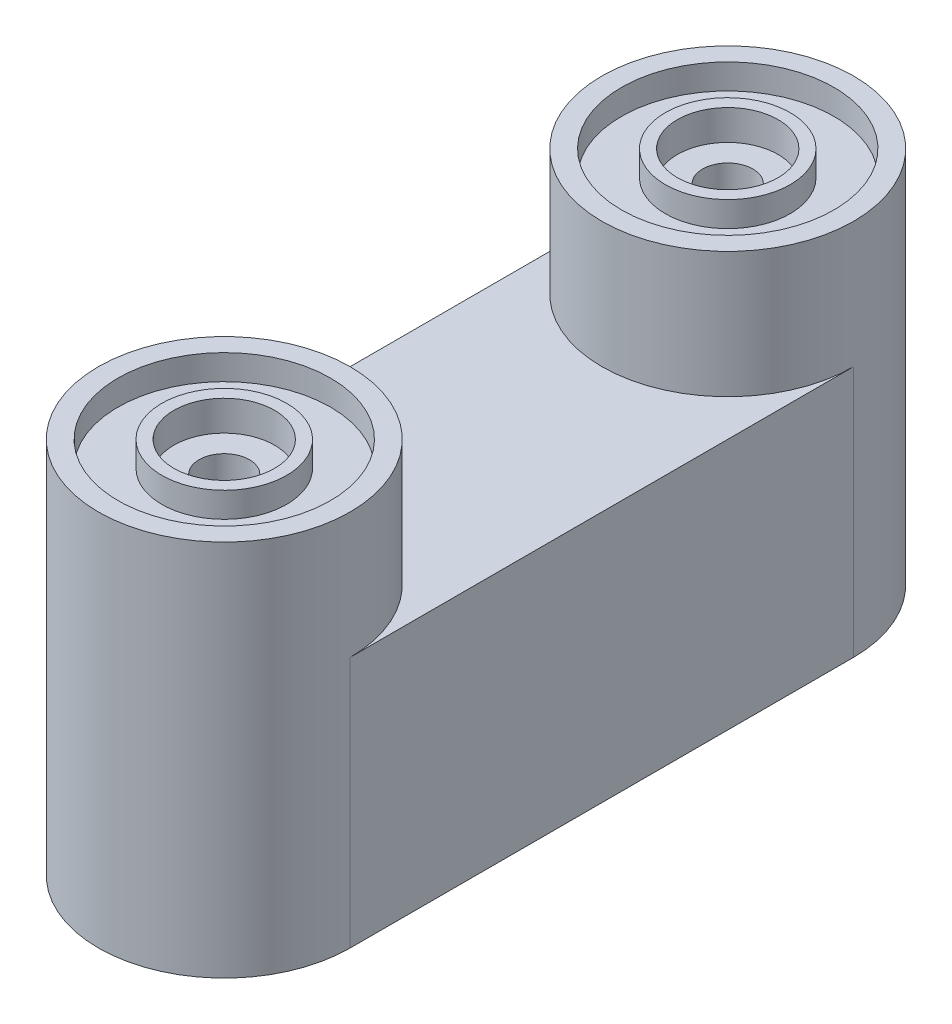
from build123d import *

# Parameters (mm, degrees)
SKIZZE1_W                       = 50
SKIZZE1_H                       = 50
AUFSATZ_LINEAR_AUSTRAGEN1_DEPTH = 150
SKIZZE2_W                       = 50
SKIZZE2_H                       = 50
AUFSATZ_LINEAR_AUSTRAGEN2_DEPTH = 25
SCHNITT_LINEAR_AUSTRAGEN1_DEPTH = 25
SCHNITT_LINEAR_AUSTRAGEN2_DEPTH = 50
SKIZZE5_R                       = 5
SCHNITT_LINEAR_AUSTRAGEN3_DEPTH = 75
SKIZZE6_R                       = 10
SCHNITT_LINEAR_AUSTRAGEN4_DEPTH = 6
SCHNITT_LINEAR_START            = -6
SKIZZE7_R                       = 10
SCHNITT_LINEAR_AUSTRAGEN5_DEPTH = 6
SKIZZE8_R                       = 21.1
SKIZZE8_R_2                     = 12.4
SCHNITT_LINEAR_AUSTRAGEN6_DEPTH = 5


with BuildPart() as part:
    # Skizze1 → Aufsatz-Linear austragen1 (new body)
    with BuildSketch(Plane.XY):
        Rectangle(SKIZZE1_W, SKIZZE1_H)
    extrude(amount=AUFSATZ_LINEAR_AUSTRAGEN1_DEPTH)

    # Skizze2 → Aufsatz-Linear austragen2 (add)
    with BuildSketch(Plane(origin=(0, 25, 0), x_dir=(1, 0, 0), z_dir=(0, 1, 0))):
        with Locations((0, -125)):
            Rectangle(SKIZZE2_W, SKIZZE2_H)
        with Locations((0, -25)):
            Rectangle(SKIZZE2_W, SKIZZE2_H)
    extrude(amount=AUFSATZ_LINEAR_AUSTRAGEN2_DEPTH)

    # Skizze3 → Schnitt-Linear austragen1 (cut)
    with BuildSketch(Plane(origin=(0, 50, 0), x_dir=(1, 0, 0), z_dir=(0, 1, 0))):
        with BuildLine():
            Line((4.2e-08, 0), (-25, 0))
            Line((-25, 0), (-25, -25))
            ThreePointArc((-25, -25), (-17.677669515, -7.322330455), (4.2e-08, 0))
        make_face()
        with BuildLine():
            Line((25, 0), (4.2e-08, 0))
            ThreePointArc((4.2e-08, 0), (17.677669545, -7.322330485), (25, -25))
            Line((25, -25), (25, 0))
        make_face()
        with BuildLine():
            ThreePointArc((0, -50), (-17.67766953, -42.67766953), (-25, -25))
            Line((-25, -25), (-25, -50))
            Line((-25, -50), (0, -50))
        make_face()
        with BuildLine():
            Line((25, -50), (25, -25))
            ThreePointArc((25, -25), (17.67766953, -42.67766953), (0, -50))
            Line((0, -50), (25, -50))
        make_face()
        with BuildLine():
            Line((-3.2e-08, -100), (-25, -100))
            Line((-25, -100), (-25, -125))
            ThreePointArc((-25, -125), (-17.677669541, -107.322330482), (-3.2e-08, -100))
        make_face()
        with BuildLine():
            Line((25, -100), (-3.2e-08, -100))
            ThreePointArc((-3.2e-08, -100), (17.677669518, -107.322330459), (25, -125))
            Line((25, -125), (25, -100))
        make_face()
        with BuildLine():
            ThreePointArc((5.8e-08, -150), (-17.677669509, -142.67766955), (-25, -125))
            Line((-25, -125), (-25, -150))
            Line((-25, -150), (5.8e-08, -150))
        make_face()
        with BuildLine():
            Line((25, -150), (25, -125))
            ThreePointArc((25, -125), (17.67766955, -142.677669509), (5.8e-08, -150))
            Line((5.8e-08, -150), (25, -150))
        make_face()
    extrude(amount=-SCHNITT_LINEAR_AUSTRAGEN1_DEPTH, mode=Mode.SUBTRACT)

    # Skizze4 → Schnitt-Linear austragen2 (cut)
    with BuildSketch(Plane(origin=(0, 25, 0), x_dir=(1, 0, 0), z_dir=(0, 1, 0))):
        with BuildLine():
            Line((25, -150), (25, -125))
            ThreePointArc((25, -125), (17.677669466, -142.677669593), (-1.79e-07, -150))
            Line((-1.79e-07, -150), (25, -150))
        make_face()
        with BuildLine():
            Line((-25, 0), (-25, -25))
            ThreePointArc((-25, -25), (-17.67766953, -7.32233047), (0, 0))
            Line((0, 0), (-25, 0))
        make_face()
        with BuildLine():
            Line((25, 0), (0, 0))
            ThreePointArc((0, 0), (17.67766953, -7.32233047), (25, -25))
            Line((25, -25), (25, 0))
        make_face()
        with BuildLine():
            ThreePointArc((-1.79e-07, -150), (-17.677669593, -142.677669466), (-25, -125))
            Line((-25, -125), (-25, -150))
            Line((-25, -150), (-1.79e-07, -150))
        make_face()
    extrude(amount=-SCHNITT_LINEAR_AUSTRAGEN2_DEPTH, mode=Mode.SUBTRACT)

    # Skizze5 → Schnitt-Linear austragen3 (cut)
    with BuildSketch(Plane(origin=(0, 50, 0), x_dir=(1, 0, 0), z_dir=(0, 1, 0))):
        with Locations((0, -25)):
            Circle(SKIZZE5_R)
        with Locations((0, -125)):
            Circle(SKIZZE5_R)
    extrude(amount=-SCHNITT_LINEAR_AUSTRAGEN3_DEPTH, mode=Mode.SUBTRACT)

    # Skizze6 → Schnitt-Linear austragen4 (cut)
    with BuildSketch(Plane(origin=(0, 50, 0), x_dir=(1, 0, 0), z_dir=(0, 1, 0))):
        with Locations((0, -125)):
            Circle(SKIZZE6_R)
        with Locations((0, -25)):
            Circle(SKIZZE6_R)
    extrude(amount=-SCHNITT_LINEAR_AUSTRAGEN4_DEPTH, mode=Mode.SUBTRACT)

    # Skizze7 → Schnitt-Linear austragen5 (cut)
    with BuildSketch(Plane.XZ.offset(25).offset(SCHNITT_LINEAR_START)):
        with Locations((0, 125)):
            Circle(SKIZZE7_R)
        with Locations((0, 25)):
            Circle(SKIZZE7_R)
    extrude(amount=SCHNITT_LINEAR_AUSTRAGEN5_DEPTH, mode=Mode.SUBTRACT)

    # Skizze8 → Schnitt-Linear austragen6 (cut)
    # profile 1 of 2: a face of its own
    with BuildSketch(Plane(origin=(0, 50, 0), x_dir=(1, 0, 0), z_dir=(0, 1, 0))):
        with Locations((0, -25)):
            Circle(SKIZZE8_R)
        with Locations((0, -25)):
            Circle(SKIZZE8_R_2, mode=Mode.SUBTRACT)
    # profile 2 of 2: a face of its own
    with BuildSketch(Plane(origin=(0, 50, 0), x_dir=(1, 0, 0), z_dir=(0, 1, 0))):
        with Locations((0, -125)):
            Circle(SKIZZE8_R)
        with Locations((0, -125)):
            Circle(SKIZZE8_R_2, mode=Mode.SUBTRACT)
    extrude(amount=-SCHNITT_LINEAR_AUSTRAGEN6_DEPTH, mode=Mode.SUBTRACT)


solid = part.part
